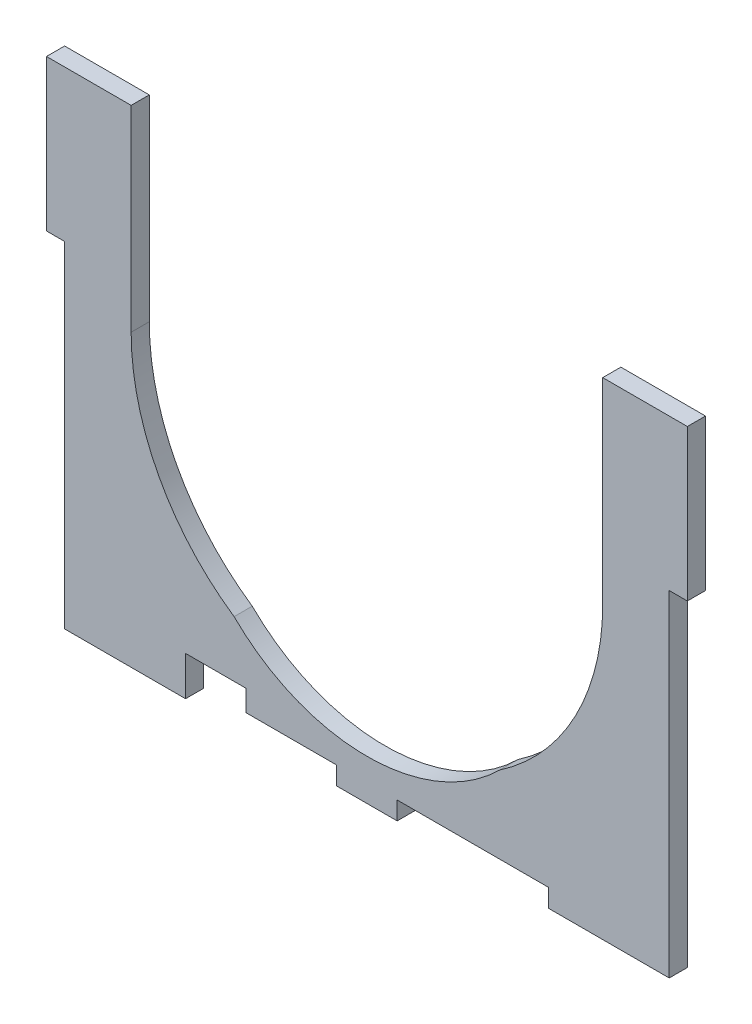
from build123d import *

# Parameters (mm, degrees)
BOSS_EXTRUDE1_DEPTH = 6
SKETCH3_W           = 6
SKETCH3_H           = 50
BOSS_EXTRUDE2_DEPTH = 6
LPATTERN1_COUNT     = 2
LPATTERN1_PITCH     = 206
SKETCH4_W           = 40
SKETCH4_H           = 6
SKETCH4_W_2         = 20
BOSS_EXTRUDE3_DEPTH = 6
SKETCH5_W           = 20
SKETCH5_H           = 7
CUT_EXTRUDE1_DEPTH  = 10


with BuildPart() as part:
    # Sketch1 → Boss-Extrude1 (new body)
    with BuildSketch(Plane.XY):
        with BuildLine():
            Line((-178, 90), (-178, 155))
            Line((-178, 155), (-200, 155))
            Line((-200, 155), (-200, 0))
            Line((-200, 0), (0, 0))
            Line((0, 0), (0, 155))
            Line((0, 155), (-22, 155))
            Line((-22, 155), (-22, 90))
            ThreePointArc((-22, 90), (-31.037807258, 53.555302549), (-56.056819802, 25.55625))
            ThreePointArc((-56.056819802, 25.55625), (-100, 7.5), (-143.943180198, 25.55625))
            ThreePointArc((-143.943180198, 25.55625), (-168.962192742, 53.555302549), (-178, 90))
        make_face()
    extrude(amount=BOSS_EXTRUDE1_DEPTH)

    # Sketch3 → Boss-Extrude2 (add)
    with BuildSketch(Plane.XY.offset(6)):
        with Locations((-203, 130)):
            Rectangle(SKETCH3_W, SKETCH3_H)
    boss_extrude2 = extrude(amount=-BOSS_EXTRUDE2_DEPTH)

    # LPattern1: Boss-Extrude2 ×2
    with Locations(*[(i * LPATTERN1_PITCH, 0, 0) for i in range(1, LPATTERN1_COUNT)]):
        add(boss_extrude2)

    # Sketch4 → Boss-Extrude3 (add)
    with BuildSketch(Plane.XY.offset(6)):
        with Locations((-180, -3)):
            Rectangle(SKETCH4_W, SKETCH4_H)
        with Locations((-100, -3)):
            Rectangle(SKETCH4_W_2, SKETCH4_H)
        with Locations((-20, -3)):
            Rectangle(SKETCH4_W, SKETCH4_H)
    extrude(amount=-BOSS_EXTRUDE3_DEPTH)

    # Sketch5 → Cut-Extrude1 (cut)
    with BuildSketch(Plane.XY.offset(6)):
        with Locations((-150, 3.5)):
            Rectangle(SKETCH5_W, SKETCH5_H)
    extrude(amount=-CUT_EXTRUDE1_DEPTH, mode=Mode.SUBTRACT)


solid = part.part
